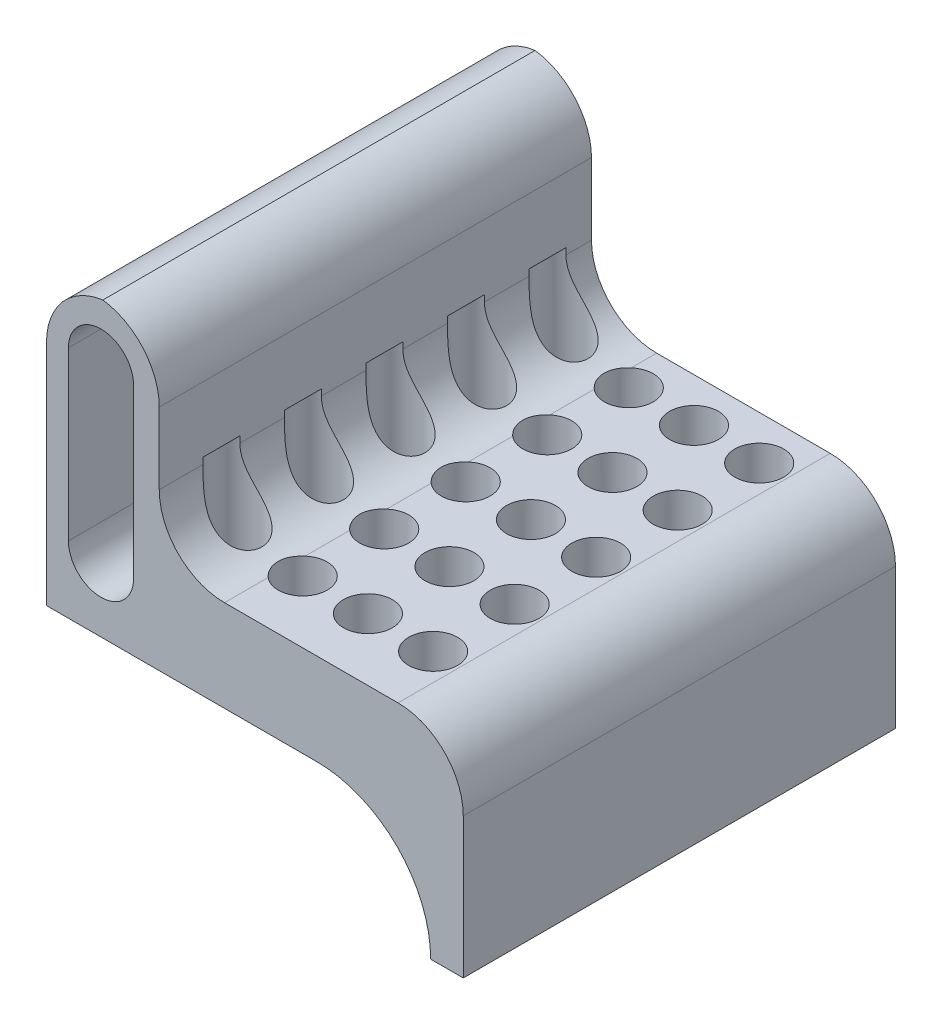
from build123d import *

# Parameters (mm, degrees)
BOSS_EXTRU_1_DEPTH           = 26.51
CONG_1_R                     = 4
ENL_V_MAT_EXTRU_1_DEPTH      = 10
ENL_V_MAT_EXTRU_1_DEPTH_BACK = 10
ESQUISSE2_R                  = 1.5


with BuildPart() as part:
    # Esquisse1 → Boss.-Extru.1 (new body)
    with BuildSketch(Plane.XY):
        with BuildLine():
            Line((6.439506286, 0), (23, 0))
            ThreePointArc((23, 0), (27.949747468, -2.050252532), (30, -7))
            Line((30, -7), (32, -7))
            Line((32, -7), (32, 5.612893416))
            Line((32, 5.612893416), (13.353710057, 5.612893416))
            Line((13.353710057, 5.612893416), (13.353710057, 18))
            Line((13.353710057, 18), (6.439506286, 18))
            Line((6.439506286, 18), (6.439506286, 0))
        make_face()
        with BuildLine():
            Line((11.781497086, 14.364879566), (11.781497086, 4.112330646))
            ThreePointArc((11.781497086, 4.112330646), (9.781497086, 2.112330646), (7.781497086, 4.112330646))
            Line((7.781497086, 4.112330646), (7.781497086, 14.364879566))
            ThreePointArc((7.781497086, 14.364879566), (9.781497086, 16.364879566), (11.781497086, 14.364879566))
        make_face(mode=Mode.SUBTRACT)
    extrude(amount=BOSS_EXTRU_1_DEPTH)

    # Congé1
    # the kernel refuses this fillet: 4 mm, written as the material it adds along each edge
    with BuildSketch(Plane(origin=(13.353710057, 5.612893416, 0), x_dir=(1, 0, 0), z_dir=(0, 0, 1))) as cong_1_piece_1:
        with BuildLine():
            CenterArc((CONG_1_R, CONG_1_R), CONG_1_R, 180, 90)
            Line((0, CONG_1_R), (0, 0))
            Line((0, 0), (CONG_1_R, 0))
        make_face()
    extrude(amount=26.51)
    # the kernel refuses this fillet: 4 mm, written as the material it takes off along each edge
    with BuildSketch(Plane(origin=(32, 5.612893416, -10), x_dir=(0, -1, 0), z_dir=(0, 0, 1))) as cong_1_2_piece_1:
        with BuildLine():
            CenterArc((CONG_1_R, -CONG_1_R), CONG_1_R, 90, 90)
            Line((0, -CONG_1_R), (0, 0))
            Line((0, 0), (CONG_1_R, 0))
        make_face()
    extrude(amount=46.51, mode=Mode.SUBTRACT)
    with BuildSketch(Plane(origin=(6.439506286, 18, -10), x_dir=(0, -1, 0), z_dir=(0, 0, 1)), Plane(origin=(13.353710057, 18, -10), x_dir=(-1, 0, 0), z_dir=(0, 0, 1))) as cong_1_2_piece_2:
        with BuildLine():
            CenterArc((CONG_1_R, CONG_1_R), CONG_1_R, 180, 90)
            Line((0, CONG_1_R), (0, 0))
            Line((0, 0), (CONG_1_R, 0))
        make_face()
    extrude(amount=46.51, mode=Mode.SUBTRACT)

    # Esquisse2 → Enlèv. mat.-Extru.1 (cut, two sides: drawn at the far end of the back side and taken through both)
    with BuildSketch(Plane.XZ.offset(-ENL_V_MAT_EXTRU_1_DEPTH_BACK)):
        with Locations(Location((14.338166194, 2.695953656, 0), (0, 0, 90))):
            Circle(ESQUISSE2_R)
        with Locations(Location((18.338166194, 2.695953656, 0), (0, 0, 90))):
            Circle(ESQUISSE2_R)
        with Locations(Location((22.338166194, 2.695953656, 0), (0, 0, 63.81809014))):
            Circle(ESQUISSE2_R)
        with Locations(Location((26.338166194, 2.695953656, 0), (0, 0, 90))):
            Circle(ESQUISSE2_R)
        with Locations(Location((18.338166194, 7.695953656, 0), (0, 0, 90))):
            Circle(ESQUISSE2_R)
        with Locations(Location((22.338166194, 7.695953656, 0), (0, 0, 63.81809014))):
            Circle(ESQUISSE2_R)
        with Locations(Location((26.338166194, 7.695953656, 0), (0, 0, 90))):
            Circle(ESQUISSE2_R)
        with Locations(Location((18.338166194, 12.695953656, 0), (0, 0, 90))):
            Circle(ESQUISSE2_R)
        with Locations(Location((22.338166194, 12.695953656, 0), (0, 0, 63.81809014))):
            Circle(ESQUISSE2_R)
        with Locations(Location((26.338166194, 12.695953656, 0), (0, 0, 90))):
            Circle(ESQUISSE2_R)
        with Locations(Location((18.338166194, 17.695953656, 0), (0, 0, 90))):
            Circle(ESQUISSE2_R)
        with Locations(Location((22.338166194, 17.695953656, 0), (0, 0, 63.81809014))):
            Circle(ESQUISSE2_R)
        with Locations(Location((26.338166194, 17.695953656, 0), (0, 0, 90))):
            Circle(ESQUISSE2_R)
        with Locations(Location((18.338166194, 22.695953656, 0), (0, 0, 90))):
            Circle(ESQUISSE2_R)
        with Locations(Location((22.338166194, 22.695953656, 0), (0, 0, 63.81809014))):
            Circle(ESQUISSE2_R)
        with Locations(Location((26.338166194, 22.695953656, 0), (0, 0, 90))):
            Circle(ESQUISSE2_R)
        with Locations(Location((14.338166194, 7.695953656, 0), (0, 0, 90))):
            Circle(ESQUISSE2_R)
        with Locations(Location((14.338166194, 12.695953656, 0), (0, 0, 90))):
            Circle(ESQUISSE2_R)
        with Locations(Location((14.338166194, 17.695953656, 0), (0, 0, 90))):
            Circle(ESQUISSE2_R)
        with Locations(Location((14.338166194, 22.695953656, 0), (0, 0, 90))):
            Circle(ESQUISSE2_R)
    extrude(amount=ENL_V_MAT_EXTRU_1_DEPTH + ENL_V_MAT_EXTRU_1_DEPTH_BACK, mode=Mode.SUBTRACT)


solid = part.part
